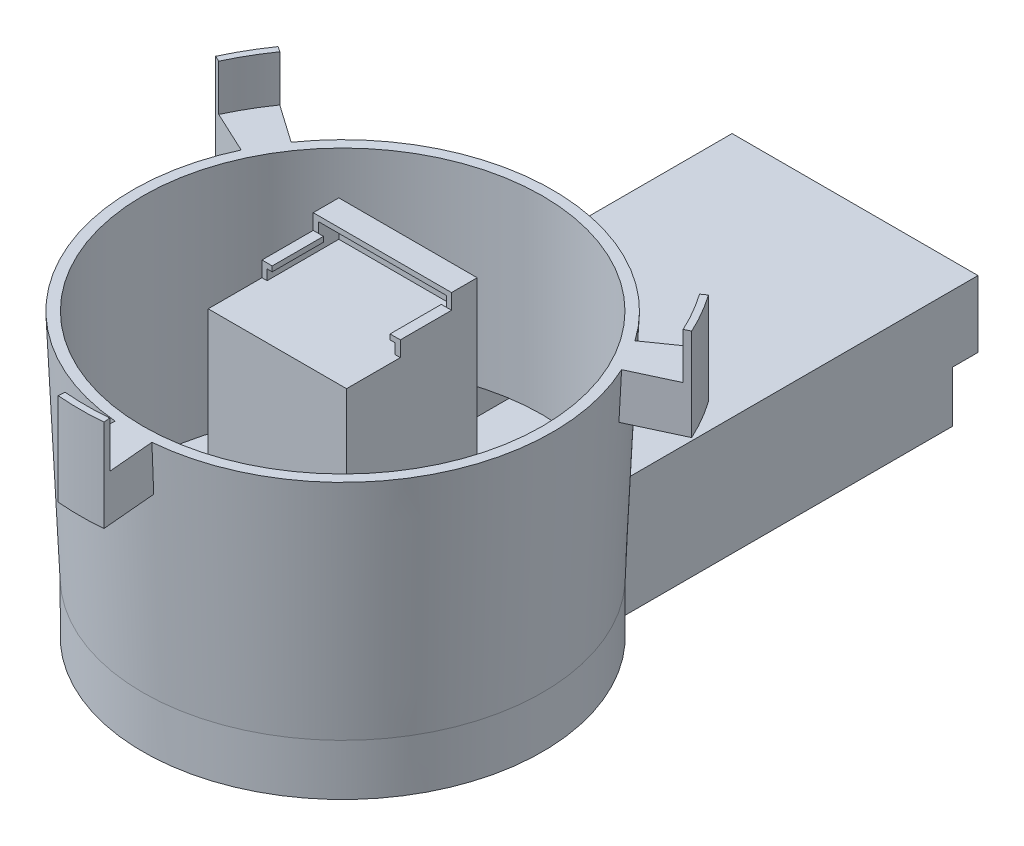
from build123d import *

# Parameters (mm, degrees)
SKETCH1_W           = 48
SKETCH1_H           = 23
BOSS_EXTRUDE1_DEPTH = 100
SKETCH2_W           = 48
SKETCH2_H           = 10
CUT_EXTRUDE1_DEPTH  = 5
SKETCH3_R           = 39
BOSS_EXTRUDE2_DEPTH = 45
BOSS_EXTRUDE2_DRAFT = -2.5
SKETCH6_R           = 27.964742431
CUT_EXTRUDE3_DEPTH  = 55
CUT_EXTRUDE3_DRAFT  = -2.5
SKETCH9_R           = 39
BOSS_EXTRUDE4_DEPTH = 10
CUT_EXTRUDE5_REACH  = 158.762
SKETCH11_W          = 38
SKETCH11_H          = 13
SKETCH12_R          = 1.5
BOSS_EXTRUDE5_DEPTH = 2
REVOLVE1_START      = 46
REVOLVE1_DEPTH      = 9
REVOLVE1_START_2    = 55
REVOLVE1_2_DEPTH    = 9
CIRPATTERN1_COUNT   = 3
SKETCH15_R          = 50.01
CUT_EXTRUDE6_DEPTH  = 75
CUT_EXTRUDE8_REACH  = 169.525
SKETCH17_R          = 38.964742431
SKETCH18_W          = 27
SKETCH18_H          = 25.5
BOSS_EXTRUDE6_DEPTH = 45
SKETCH19_W          = 27
SKETCH19_H          = 5
BOSS_EXTRUDE7_DEPTH = 6
SKETCH20_W          = 25
SKETCH20_H          = 5
CUT_EXTRUDE9_DEPTH  = 4
SKETCH21_W          = 21
SKETCH21_H          = 2.5
CUT_EXTRUDE10_DEPTH = 119.502093026
SKETCH22_W          = 2
SKETCH22_H          = 10
BOSS_EXTRUDE8_DEPTH = 3
SKETCH23_W          = 1
SKETCH23_H          = 2
CUT_EXTRUDE11_DEPTH = 14


# Read off the part's stored shape, not the designer's step: Revolve1
with BuildPart() as part:
    # Sketch1 → Boss-Extrude1 (new body)
    with BuildSketch(Plane.XY):
        with Locations((0, 11.5)):
            Rectangle(SKETCH1_W, SKETCH1_H)
    extrude(amount=BOSS_EXTRUDE1_DEPTH)

    # Sketch2 → Cut-Extrude1 (cut)
    with BuildSketch(Plane.XY):
        with Locations((0, 5)):
            Rectangle(SKETCH2_W, SKETCH2_H)
    extrude(amount=CUT_EXTRUDE1_DEPTH, mode=Mode.SUBTRACT)


with BuildPart() as boss_extrude2_tool:
    # Sketch3 → Boss-Extrude2 (with draft: the straight prism first)
    with BuildSketch(Plane(origin=(0, 10, 0), x_dir=(-1, 0, 0), z_dir=(0, 1, 0))):
        with Locations((0, 100)):
            Circle(SKETCH3_R)
    extrude(amount=BOSS_EXTRUDE2_DEPTH)
    # Boss-Extrude2: the draft: its side faces are tilted about the plane it starts from
    boss_extrude2_sides = [boss_extrude2_tool.faces().sort_by_distance(p)[0] for p in [
        (39, 32.5, 100),
    ]]
    draft(boss_extrude2_sides, Plane(origin=(0, 10, 0), x_dir=(-1, 0, 0), z_dir=(0, 1, 0)), BOSS_EXTRUDE2_DRAFT)


with BuildPart() as part_1:
    add(part.part)

    # Boss-Extrude2: add boss_extrude2_tool
    add(boss_extrude2_tool.part)


with BuildPart() as cut_extrude3_tool:
    # Sketch6 → Cut-Extrude3 (with draft: the straight prism first)
    with BuildSketch(Plane(origin=(0, 55, 0), x_dir=(1, 0, 0), z_dir=(0, 1, 0))):
        with Locations((0, -100)):
            Circle(SKETCH6_R)
    extrude(amount=-CUT_EXTRUDE3_DEPTH)
    # Cut-Extrude3: the draft: its side faces are tilted about the plane it starts from
    cut_extrude3_sides = [cut_extrude3_tool.faces().sort_by_distance(p)[0] for p in [
        (-27.964742431, 27.5, 100),
    ]]
    draft(cut_extrude3_sides, Plane(origin=(0, 55, 0), x_dir=(1, 0, 0), z_dir=(0, 1, 0)), CUT_EXTRUDE3_DRAFT)


with BuildPart() as part_2:
    add(part_1.part)

    # Cut-Extrude3: cut by cut_extrude3_tool
    add(cut_extrude3_tool.part, mode=Mode.SUBTRACT)

    # Sketch9 → Boss-Extrude4 (add)
    with BuildSketch(Plane.XZ.offset(-10)):
        with Locations((0, 100)):
            Circle(SKETCH9_R)
    extrude(amount=BOSS_EXTRUDE4_DEPTH)

    # Cut-Extrude5: up to this cone (the profile starts outside it)
    cut_extrude5_end = Plane(origin=(0, 11.5, 100), z_dir=(0, 1, 0)) * Cone(17.973918392, 34.157064436, 370.654982829, mode=Mode.PRIVATE)
    # Sketch11 → Cut-Extrude5 (cut, up to the surface)
    with BuildSketch(Plane(origin=(0, 0, 0), x_dir=(-1, 0, 0), z_dir=(0, 0, -1)), mode=Mode.PRIVATE) as cut_extrude5_sk1:
        with Locations((0, 11.5)):
            Rectangle(SKETCH11_W, SKETCH11_H)
    cut_extrude5_tool1 = extrude(cut_extrude5_sk1.sketch, amount=-CUT_EXTRUDE5_REACH, mode=Mode.PRIVATE) - cut_extrude5_end
    add(cut_extrude5_tool1.solids().sort_by_distance((0, 11.5, 0))[0], mode=Mode.SUBTRACT)

    # Sketch12 → Boss-Extrude5 (add)
    with BuildSketch(Plane(origin=(0, 55, 0), x_dir=(1, 0, 0), z_dir=(0, 1, 0))):
        with Locations(Location((32, -100, 0), (0, 0, 90))):
            Circle(SKETCH12_R)
        with Locations(Location((-32, -100, 0), (0, 0, 270))):
            Circle(SKETCH12_R)
    extrude(amount=BOSS_EXTRUDE5_DEPTH)

    # Revolve1 outline → Revolve1 (add)
    with BuildSketch(Plane(origin=(0, 0, 0), x_dir=(1, 0, 0), z_dir=(0, 1, 0)).offset(REVOLVE1_START)):
        with BuildLine():
            Line((-3.536064836, -140.41740602), (-4.468016703, -151.069664609))
            ThreePointArc((-4.468016703, -151.069664609), (0, -151.264742431), (4.468016703, -151.069664609))
            Line((4.468016703, -151.069664609), (3.536064836, -140.41740602))
            Line((3.536064836, -140.41740602), (3.499546541, -140))
            Line((3.499546541, -140), (-3.499546541, -140))
            Line((-3.499546541, -140), (-3.536064836, -140.41740602))
        make_face()
    revolve1 = extrude(amount=REVOLVE1_DEPTH)

    # Revolve1 2 outline → Revolve1 2 (add)
    with BuildSketch(Plane(origin=(0, 0, 0), x_dir=(1, 0, 0), z_dir=(0, 1, 0)).offset(REVOLVE1_START_2)):
        with BuildLine():
            ThreePointArc((4.293705218, -149.077275213), (0, -149.264742431), (-4.293705218, -149.077275213))
            Line((-4.293705218, -149.077275213), (-4.468016703, -151.069664609))
            ThreePointArc((-4.468016703, -151.069664609), (0, -151.264742431), (4.468016703, -151.069664609))
            Line((4.468016703, -151.069664609), (4.293705218, -149.077275213))
        make_face()
    revolve1_2 = extrude(amount=REVOLVE1_2_DEPTH)

    # CirPattern1: Revolve1, Revolve1 2 ×3 about axis
    cirpattern1_axis = Axis((0, 0, 100), (0, 1, 0))
    add([revolve1.rotate(cirpattern1_axis, i * 360 / CIRPATTERN1_COUNT) for i in range(1, CIRPATTERN1_COUNT)])
    add([revolve1_2.rotate(cirpattern1_axis, i * 360 / CIRPATTERN1_COUNT) for i in range(1, CIRPATTERN1_COUNT)])

    # Sketch15 → Cut-Extrude6 (cut)
    with BuildSketch(Plane(origin=(0, 130, 0), x_dir=(1, 0, 0), z_dir=(0, 1, 0))):
        with Locations((0, -100)):
            Circle(SKETCH15_R)
    extrude(amount=-CUT_EXTRUDE6_DEPTH, mode=Mode.SUBTRACT)

    # Cut-Extrude8: up to this face of the body (flat: up to its plane)
    cut_extrude8_end = Plane(part_2.part.faces().sort_by_distance((0, 10, 100))[0])
    # Sketch17 → Cut-Extrude8 (cut, up to the picked face)
    with BuildSketch(Plane(origin=(0, 55, 0), x_dir=(1, 0, 0), z_dir=(0, 1, 0)), mode=Mode.PRIVATE) as cut_extrude8_sk1:
        with Locations(Location((0, -100, 0), (0, 0, 270))):
            Circle(SKETCH17_R)
    cut_extrude8_tool1 = split(extrude(cut_extrude8_sk1.sketch, amount=-CUT_EXTRUDE8_REACH, mode=Mode.PRIVATE), bisect_by=cut_extrude8_end, keep=Keep.BOTH, mode=Mode.PRIVATE)
    add(cut_extrude8_tool1.solids().sort_by(Axis((0, 55, 100), (0, -1, 0)))[0], mode=Mode.SUBTRACT)

    # Sketch18 → Boss-Extrude6 (add)
    with BuildSketch(Plane(origin=(0, 10, 0), x_dir=(1, 0, 0), z_dir=(0, 1, 0))):
        with Locations((0, -100)):
            Rectangle(SKETCH18_W, SKETCH18_H)
    extrude(amount=BOSS_EXTRUDE6_DEPTH)

    # Sketch19 → Boss-Extrude7 (add)
    with BuildSketch(Plane(origin=(0, 55, 0), x_dir=(1, 0, 0), z_dir=(0, 1, 0))):
        with Locations((0, -89.75)):
            Rectangle(SKETCH19_W, SKETCH19_H)
    extrude(amount=BOSS_EXTRUDE7_DEPTH)

    # Sketch20 → Cut-Extrude9 (cut)
    with BuildSketch(Plane.XY.offset(92.25)):
        with Locations((0, 57.5)):
            Rectangle(SKETCH20_W, SKETCH20_H)
    extrude(amount=-CUT_EXTRUDE9_DEPTH, mode=Mode.SUBTRACT)

    # Sketch21 → Cut-Extrude10 (cut, through all)
    with BuildSketch(Plane.XY.offset(88.25)):
        with Locations((0, 57.75)):
            Rectangle(SKETCH21_W, SKETCH21_H)
    extrude(amount=-CUT_EXTRUDE10_DEPTH, mode=Mode.SUBTRACT)

    # Sketch22 → Boss-Extrude8 (add)
    with BuildSketch(Plane(origin=(0, 55, 0), x_dir=(1, 0, 0), z_dir=(0, 1, 0))):
        with Locations((-12.5, -97.25)):
            Rectangle(SKETCH22_W, SKETCH22_H)
        with Locations((12.5, -97.25)):
            Rectangle(SKETCH22_W, SKETCH22_H)
    extrude(amount=BOSS_EXTRUDE8_DEPTH)

    # Sketch23 → Cut-Extrude11 (cut)
    with BuildSketch(Plane.XY.offset(102.25)):
        with Locations((12, 56)):
            Rectangle(SKETCH23_W, SKETCH23_H)
        with Locations((-12, 56)):
            Rectangle(SKETCH23_W, SKETCH23_H)
    extrude(amount=-CUT_EXTRUDE11_DEPTH, mode=Mode.SUBTRACT)


solid = part_2.part
